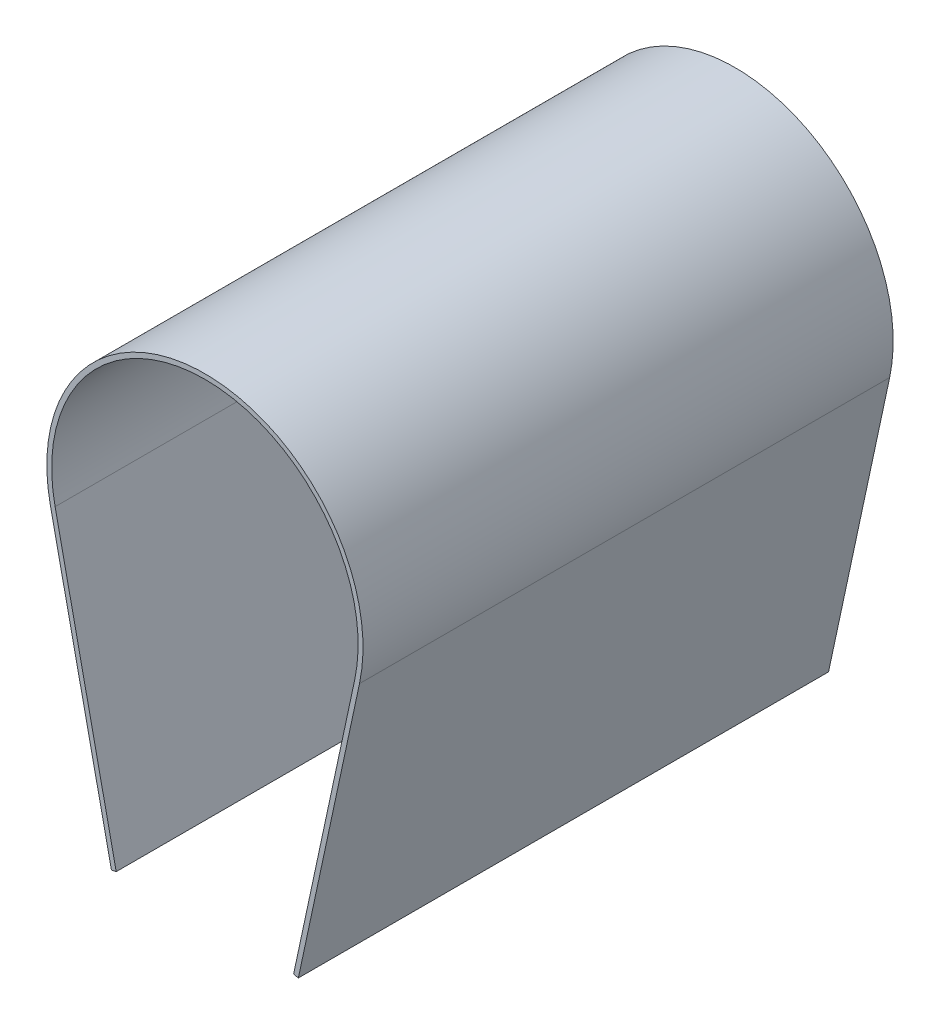
from build123d import *

# Parameters (mm, degrees)
CROSS_SECTION_EXTRUDE_DEPTH = 2180


with BuildPart() as part:
    # Cross Section Sketch → Cross Section Extrude (new body)
    with BuildSketch(Plane.XY):
        with BuildLine():
            Line((-384.219184204, -1310), (-364.662530291, -1305.812245506))
            Line((-364.662530291, -1305.812245506), (-616.034598278, -131.914266571))
            ThreePointArc((-616.034598278, -131.914266571), (0, 630), (616.034598278, -131.914266571))
            Line((616.034598278, -131.914266571), (364.662530291, -1305.812245506))
            Line((364.662530291, -1305.812245506), (384.219184204, -1310))
            Line((384.219184204, -1310), (635.591252191, -136.102021065))
            ThreePointArc((635.591252191, -136.102021065), (0, 650), (-635.591252191, -136.102021065))
            Line((-635.591252191, -136.102021065), (-384.219184204, -1310))
        make_face()
    extrude(amount=CROSS_SECTION_EXTRUDE_DEPTH)


solid = part.part
